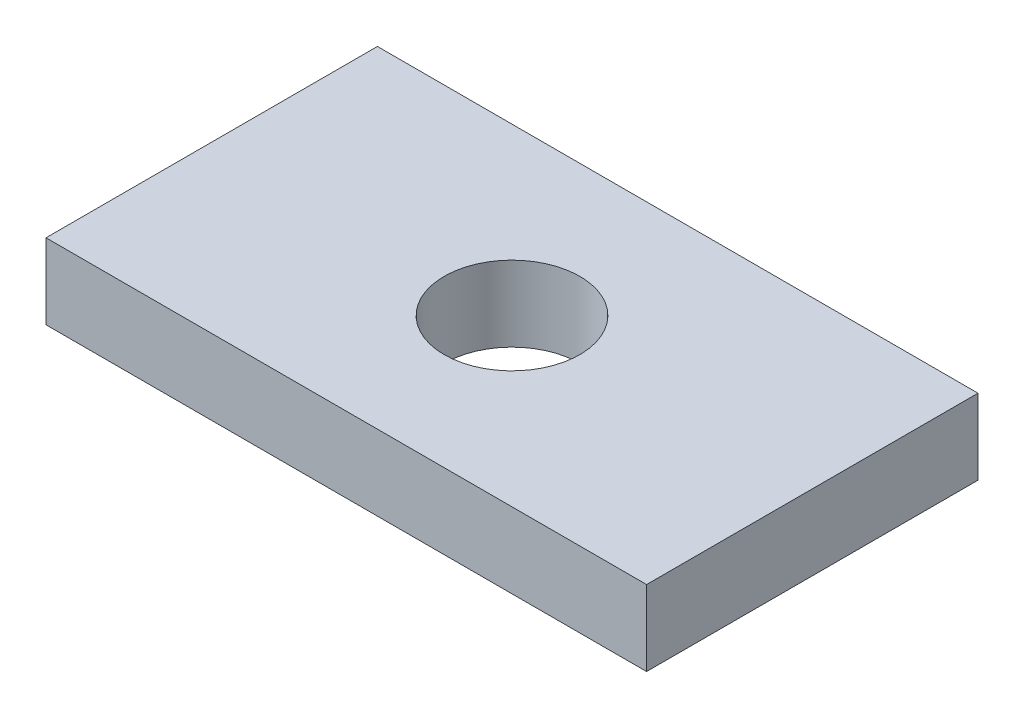
from build123d import *

# Parameters (mm, degrees)
SKETCH_1_W          = 79.688684703
SKETCH_1_H          = 43.973938877
EXTRUDE_1_DEPTH     = 10
SKETCH_2_R          = 9
CUT_EXTRUDE_1_DEPTH = 92.564151118


with BuildPart() as part:
    # Эскиз1 → Вытянуть1 (new body)
    with BuildSketch(Plane(origin=(0, 0, 0), x_dir=(1, 0, 0), z_dir=(0, 1, 0))):
        with Locations((39.844342352, -21.986969439)):
            Rectangle(SKETCH_1_W, SKETCH_1_H)
    extrude(amount=EXTRUDE_1_DEPTH)

    # Эскиз2 → Вырез-Вытянуть1 (cut, through all)
    with BuildSketch(Plane(origin=(0, 10, 0), x_dir=(1, 0, 0), z_dir=(0, 1, 0))):
        with Locations((39.844342351, -21.986969438)):
            Circle(SKETCH_2_R)
    extrude(amount=-CUT_EXTRUDE_1_DEPTH, mode=Mode.SUBTRACT)


solid = part.part
